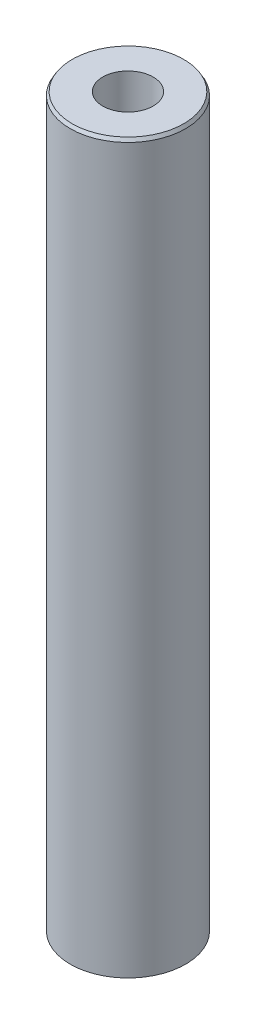
from build123d import *
from OCP.BRepFilletAPI import BRepFilletAPI_MakeChamfer

# Parameters (mm, degrees)
SKETCH1_R           = 47.5
BOSS_EXTRUDE1_DEPTH = 600
SKETCH2_R           = 20.755412647
CUT_EXTRUDE1_DEPTH  = 604.748706003
CHAMFER1_SIZE       = 2.746953134
CHAMFER1_SIZE2      = 1.585954131


with BuildPart() as part:
    # Sketch1 → Boss-Extrude1 (new body)
    with BuildSketch(Plane(origin=(0, 0, 0), x_dir=(1, 0, 0), z_dir=(0, 1, 0))):
        Circle(SKETCH1_R)
    extrude(amount=BOSS_EXTRUDE1_DEPTH)

    # Sketch2 → Cut-Extrude1 (cut, through all)
    with BuildSketch(Plane(origin=(0, 0, 0), x_dir=(1, 0, 0), z_dir=(0, 1, 0))):
        Circle(SKETCH2_R)
    extrude(amount=CUT_EXTRUDE1_DEPTH, mode=Mode.SUBTRACT)

    # Chamfer1: one chamfer whose edges measure the first distance from different faces: ONE call of the kernel's chamfer builder (chamfer() names one face for all edges)
    chamfer1_edges_1 = [part.edges().sort_by_distance(p)[0] for p in [
        (-47.5, 600, 0),
    ]]
    chamfer1_side_1 = [part.faces().sort_by_distance(p)[0] for p in [
        (-47.5, 300, 0),
    ]]
    chamfer1_edges_2 = [part.edges().sort_by_distance(p)[0] for p in [
        (-47.5, 0, 0),
    ]]
    chamfer1_side_2 = [part.faces().sort_by_distance(p)[0] for p in [
        (-46.156497116, 0, 0),
    ]]
    chamfer1 = BRepFilletAPI_MakeChamfer(part.part.solid().wrapped)
    for e in chamfer1_edges_1:
        chamfer1.Add(CHAMFER1_SIZE, CHAMFER1_SIZE2, e.wrapped, chamfer1_side_1[0].wrapped)  # the first distance lies on this face
    for e in chamfer1_edges_2:
        chamfer1.Add(CHAMFER1_SIZE, CHAMFER1_SIZE2, e.wrapped, chamfer1_side_2[0].wrapped)  # the first distance lies on this face
    add(Compound.cast(chamfer1.Shape()), mode=Mode.REPLACE)


solid = part.part
